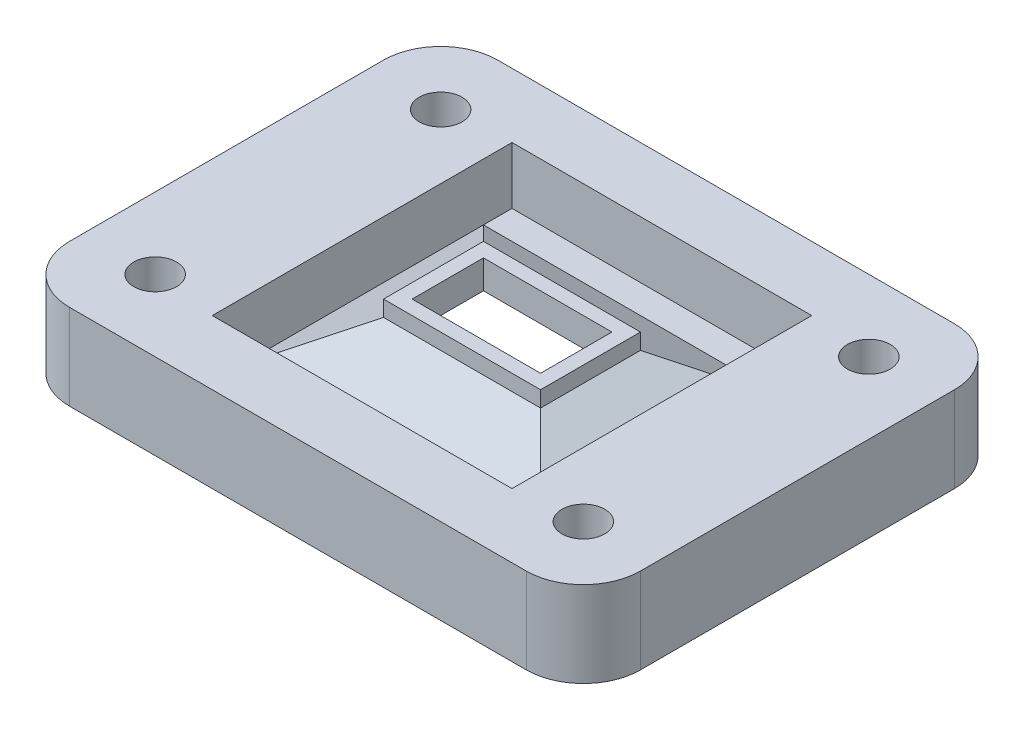
from build123d import *
from OCP.BRepFilletAPI import BRepFilletAPI_MakeChamfer

# Parameters (mm, degrees)
SKETCH1_W           = 40
SKETCH1_H           = 30
BOSS_EXTRUDE1_DEPTH = 6
SKETCH2_R           = 1.5
CUT_EXTRUDE1_DEPTH  = 6
FILLET1_R           = 4
SKETCH3_W           = 21
SKETCH3_H           = 21
CUT_EXTRUDE2_DEPTH  = 4
SKETCH6_W           = 9
SKETCH6_H           = 5
CUT_EXTRUDE3_DEPTH  = 2
SKETCH7_W           = 11
SKETCH7_H           = 7
SKETCH7_W_2         = 9
SKETCH7_H_2         = 5
BOSS_EXTRUDE2_DEPTH = 4
CHAMFER1_SIZE       = 4
CHAMFER1_SIZE2      = 6.92820323
CHAMFER2_SIZE       = 2.886751346
CHAMFER2_SIZE_2     = 5


with BuildPart() as part:
    # Sketch1 → Boss-Extrude1 (new body)
    with BuildSketch(Plane(origin=(0, 0, 0), x_dir=(1, 0, 0), z_dir=(0, 1, 0))):
        with Locations((20, 15)):
            Rectangle(SKETCH1_W, SKETCH1_H)
    extrude(amount=BOSS_EXTRUDE1_DEPTH)

    # Sketch2 → Cut-Extrude1 (cut)
    with BuildSketch(Plane(origin=(0, 6, 0), x_dir=(1, 0, 0), z_dir=(0, 1, 0))):
        with Locations(Location((5, 5, 0), (0, 0, 270))):
            Circle(SKETCH2_R)
        with Locations(Location((5, 25, 0), (0, 0, 90))):
            Circle(SKETCH2_R)
        with Locations(Location((35, 5, 0), (0, 0, 90))):
            Circle(SKETCH2_R)
        with Locations(Location((35, 25, 0), (0, 0, 270))):
            Circle(SKETCH2_R)
    extrude(amount=-CUT_EXTRUDE1_DEPTH, mode=Mode.SUBTRACT)

    # Fillet1
    fillet1_edges = [part.edges().sort_by_distance(p)[0] for p in [
        (0, 3, -30),
        (40, 3, -30),
        (40, 3, 0),
        (0, 3, 0),
    ]]
    fillet(fillet1_edges, radius=FILLET1_R)

    # Sketch3 → Cut-Extrude2 (cut)
    with BuildSketch(Plane(origin=(0, 6, 0), x_dir=(1, 0, 0), z_dir=(0, 1, 0))):
        with Locations((20, 15)):
            Rectangle(SKETCH3_W, SKETCH3_H)
    extrude(amount=-CUT_EXTRUDE2_DEPTH, mode=Mode.SUBTRACT)

    # Sketch6 → Cut-Extrude3 (cut)
    with BuildSketch(Plane(origin=(0, 2, 0), x_dir=(1, 0, 0), z_dir=(0, 1, 0))):
        with Locations((20, 15)):
            Rectangle(SKETCH6_W, SKETCH6_H)
    extrude(amount=-CUT_EXTRUDE3_DEPTH, mode=Mode.SUBTRACT)

    # Sketch7 → Boss-Extrude2 (add)
    with BuildSketch(Plane(origin=(0, 2, 0), x_dir=(1, 0, 0), z_dir=(0, 1, 0))):
        with Locations((20, 15)):
            Rectangle(SKETCH7_W, SKETCH7_H)
        with Locations((20, 15)):
            Rectangle(SKETCH7_W_2, SKETCH7_H_2, mode=Mode.SUBTRACT)
    extrude(amount=BOSS_EXTRUDE2_DEPTH)

    # Chamfer1: one chamfer whose edges measure the first distance from different faces: ONE call of the kernel's chamfer builder (chamfer() names one face for all edges)
    chamfer1_edges_1 = [part.edges().sort_by_distance(p)[0] for p in [
        (20, 0, -12.5),
    ]]
    chamfer1_side_1 = [part.faces().sort_by_distance(p)[0] for p in [
        (20, 3, -12.5),
    ]]
    chamfer1_edges_2 = [part.edges().sort_by_distance(p)[0] for p in [
        (24.5, 0, -15),
    ]]
    chamfer1_side_2 = [part.faces().sort_by_distance(p)[0] for p in [
        (24.5, 3, -15),
    ]]
    chamfer1_edges_3 = [part.edges().sort_by_distance(p)[0] for p in [
        (20, 0, -17.5),
    ]]
    chamfer1_side_3 = [part.faces().sort_by_distance(p)[0] for p in [
        (20, 3, -17.5),
    ]]
    chamfer1_edges_4 = [part.edges().sort_by_distance(p)[0] for p in [
        (15.5, 0, -15),
    ]]
    chamfer1_side_4 = [part.faces().sort_by_distance(p)[0] for p in [
        (15.5, 3, -15),
    ]]
    chamfer1 = BRepFilletAPI_MakeChamfer(part.part.solid().wrapped)
    for e in chamfer1_edges_1:
        chamfer1.Add(CHAMFER1_SIZE, CHAMFER1_SIZE2, e.wrapped, chamfer1_side_1[0].wrapped)  # the first distance lies on this face
    for e in chamfer1_edges_2:
        chamfer1.Add(CHAMFER1_SIZE, CHAMFER1_SIZE2, e.wrapped, chamfer1_side_2[0].wrapped)  # the first distance lies on this face
    for e in chamfer1_edges_3:
        chamfer1.Add(CHAMFER1_SIZE, CHAMFER1_SIZE2, e.wrapped, chamfer1_side_3[0].wrapped)  # the first distance lies on this face
    for e in chamfer1_edges_4:
        chamfer1.Add(CHAMFER1_SIZE, CHAMFER1_SIZE2, e.wrapped, chamfer1_side_4[0].wrapped)  # the first distance lies on this face
    add(Compound.cast(chamfer1.Shape()), mode=Mode.REPLACE)

    # Chamfer2
    # the kernel refuses this chamfer: 5, 2.886751346 mm, written as the material it adds along each edge
    with BuildSketch(Plane(origin=(14.5, 2, -31.435428773), x_dir=(0, 1, 0), z_dir=(0, 0, 1))) as chamfer2_piece_1_section:
        Polygon((CHAMFER2_SIZE, 0), (0, CHAMFER2_SIZE_2), (0, 0), align=None)
    chamfer2_piece_1 = extrude(amount=32.870857546, mode=Mode.PRIVATE)
    chamfer2_piece_1 = split(chamfer2_piece_1, bisect_by=Plane(origin=(13.883974596, 3.066987298, -31.435428773), z_dir=(-0.499999999999998, 0.8660254037844398, 0)), keep=Keep.TOP, mode=Mode.PRIVATE)
    chamfer2_piece_1 = split(chamfer2_piece_1, bisect_by=Plane(origin=(14.5, -1.436141454, -29.45157158), z_dir=(0, -0.8660254037844382, 0.500000000000001)), keep=Keep.TOP, mode=Mode.PRIVATE)
    chamfer2_piece_1 = split(chamfer2_piece_1, bisect_by=Plane(origin=(14.5, 12.797357386, -25.20157158), z_dir=(0, -0.8660254037844382, -0.500000000000001)), keep=Keep.TOP, mode=Mode.PRIVATE)
    with BuildSketch(Plane(origin=(14.5, 2, -31.435428773), x_dir=(0, 1, 0), z_dir=(0, 0, 1))) as chamfer2_piece_2_section:
        Polygon((CHAMFER2_SIZE, 0), (0, CHAMFER2_SIZE_2), (0, 0), align=None)
    chamfer2_piece_2 = extrude(amount=32.870857546, mode=Mode.PRIVATE)
    chamfer2_piece_2 = split(chamfer2_piece_2, bisect_by=Plane(origin=(14.5, -2.534217665, -28.817596984), z_dir=(0, 0.8660254037844398, -0.499999999999998)), keep=Keep.TOP, mode=Mode.PRIVATE)
    chamfer2_piece_2 = split(chamfer2_piece_2, bisect_by=Plane(origin=(14.5, -1.436141454, -29.45157158), z_dir=(0, -0.8660254037844382, 0.500000000000001)), keep=Keep.TOP, mode=Mode.PRIVATE)
    with BuildSketch(Plane(origin=(14.5, 2, -31.435428773), x_dir=(0, 1, 0), z_dir=(0, 0, 1))) as chamfer2_piece_3_section:
        Polygon((CHAMFER2_SIZE, 0), (0, CHAMFER2_SIZE_2), (0, 0), align=None)
    chamfer2_piece_3 = extrude(amount=32.870857546, mode=Mode.PRIVATE)
    chamfer2_piece_3 = split(chamfer2_piece_3, bisect_by=Plane(origin=(14.5, 11.699281175, -25.835546176), z_dir=(0, 0.8660254037844398, 0.49999999999999795)), keep=Keep.TOP, mode=Mode.PRIVATE)
    chamfer2_piece_3 = split(chamfer2_piece_3, bisect_by=Plane(origin=(14.5, 12.797357386, -25.20157158), z_dir=(0, -0.8660254037844382, -0.500000000000001)), keep=Keep.TOP, mode=Mode.PRIVATE)
    with BuildSketch(Plane(origin=(1.564571227, 2, -11.5), x_dir=(0, 1, 0), z_dir=(1, 0, 0))) as chamfer2_piece_4_section:
        Polygon((CHAMFER2_SIZE, 0), (0, CHAMFER2_SIZE_2), (0, 0), align=None)
    chamfer2_piece_4 = extrude(amount=36.870857546, mode=Mode.PRIVATE)
    chamfer2_piece_4 = split(chamfer2_piece_4, bisect_by=Plane(origin=(1.564571227, 3.066987298, -10.883974596), z_dir=(0, 0.8660254037844398, 0.49999999999999795)), keep=Keep.TOP, mode=Mode.PRIVATE)
    chamfer2_piece_4 = split(chamfer2_piece_4, bisect_by=Plane(origin=(8.79842842, 14.529408194, -11.5), z_dir=(-0.500000000000001, -0.8660254037844382, 0)), keep=Keep.TOP, mode=Mode.PRIVATE)
    chamfer2_piece_4 = split(chamfer2_piece_4, bisect_by=Plane(origin=(3.54842842, -1.436141454, -11.5), z_dir=(0.500000000000001, -0.8660254037844382, 0)), keep=Keep.TOP, mode=Mode.PRIVATE)
    with BuildSketch(Plane(origin=(1.564571227, 2, -11.5), x_dir=(0, 1, 0), z_dir=(1, 0, 0))) as chamfer2_piece_5_section:
        Polygon((CHAMFER2_SIZE, 0), (0, CHAMFER2_SIZE_2), (0, 0), align=None)
    chamfer2_piece_5 = extrude(amount=36.870857546, mode=Mode.PRIVATE)
    chamfer2_piece_5 = split(chamfer2_piece_5, bisect_by=Plane(origin=(4.182403016, -2.534217665, -11.5), z_dir=(-0.499999999999998, 0.8660254037844398, 0)), keep=Keep.TOP, mode=Mode.PRIVATE)
    chamfer2_piece_5 = split(chamfer2_piece_5, bisect_by=Plane(origin=(3.54842842, -1.436141454, -11.5), z_dir=(0.500000000000001, -0.8660254037844382, 0)), keep=Keep.TOP, mode=Mode.PRIVATE)
    with BuildSketch(Plane(origin=(25.5, 2, 1.435428773), x_dir=(0, 1, 0), z_dir=(0, 0, -1))) as chamfer2_piece_6_section:
        Polygon((CHAMFER2_SIZE, 0), (0, CHAMFER2_SIZE_2), (0, 0), align=None)
    chamfer2_piece_6 = extrude(amount=32.870857546, mode=Mode.PRIVATE)
    chamfer2_piece_6 = split(chamfer2_piece_6, bisect_by=Plane(origin=(26.116025404, 3.066987298, 1.435428773), z_dir=(0.499999999999998, 0.8660254037844398, 0)), keep=Keep.TOP, mode=Mode.PRIVATE)
    chamfer2_piece_6 = split(chamfer2_piece_6, bisect_by=Plane(origin=(25.5, 12.797357386, -4.79842842), z_dir=(0, -0.8660254037844382, 0.500000000000001)), keep=Keep.TOP, mode=Mode.PRIVATE)
    chamfer2_piece_6 = split(chamfer2_piece_6, bisect_by=Plane(origin=(25.5, -1.436141454, -0.54842842), z_dir=(0, -0.8660254037844382, -0.500000000000001)), keep=Keep.TOP, mode=Mode.PRIVATE)
    with BuildSketch(Plane(origin=(25.5, 2, 1.435428773), x_dir=(0, 1, 0), z_dir=(0, 0, -1))) as chamfer2_piece_7_section:
        Polygon((CHAMFER2_SIZE, 0), (0, CHAMFER2_SIZE_2), (0, 0), align=None)
    chamfer2_piece_7 = extrude(amount=32.870857546, mode=Mode.PRIVATE)
    chamfer2_piece_7 = split(chamfer2_piece_7, bisect_by=Plane(origin=(25.5, -2.534217665, -1.182403016), z_dir=(0, 0.8660254037844398, 0.49999999999999795)), keep=Keep.TOP, mode=Mode.PRIVATE)
    chamfer2_piece_7 = split(chamfer2_piece_7, bisect_by=Plane(origin=(25.5, -1.436141454, -0.54842842), z_dir=(0, -0.8660254037844382, -0.500000000000001)), keep=Keep.TOP, mode=Mode.PRIVATE)
    with BuildSketch(Plane(origin=(25.5, 2, 1.435428773), x_dir=(0, 1, 0), z_dir=(0, 0, -1))) as chamfer2_piece_8_section:
        Polygon((CHAMFER2_SIZE, 0), (0, CHAMFER2_SIZE_2), (0, 0), align=None)
    chamfer2_piece_8 = extrude(amount=32.870857546, mode=Mode.PRIVATE)
    chamfer2_piece_8 = split(chamfer2_piece_8, bisect_by=Plane(origin=(25.5, 11.699281175, -4.164453824), z_dir=(0, 0.8660254037844398, -0.499999999999998)), keep=Keep.TOP, mode=Mode.PRIVATE)
    chamfer2_piece_8 = split(chamfer2_piece_8, bisect_by=Plane(origin=(25.5, 12.797357386, -4.79842842), z_dir=(0, -0.8660254037844382, 0.500000000000001)), keep=Keep.TOP, mode=Mode.PRIVATE)
    with BuildSketch(Plane(origin=(38.435428773, 2, -18.5), x_dir=(0, 1, 0), z_dir=(-1, 0, 0))) as chamfer2_piece_9_section:
        Polygon((CHAMFER2_SIZE, 0), (0, CHAMFER2_SIZE_2), (0, 0), align=None)
    chamfer2_piece_9 = extrude(amount=36.870857546, mode=Mode.PRIVATE)
    chamfer2_piece_9 = split(chamfer2_piece_9, bisect_by=Plane(origin=(38.435428773, 3.066987298, -19.116025404), z_dir=(0, 0.8660254037844398, -0.499999999999998)), keep=Keep.TOP, mode=Mode.PRIVATE)
    chamfer2_piece_9 = split(chamfer2_piece_9, bisect_by=Plane(origin=(36.45157158, -1.436141454, -18.5), z_dir=(-0.500000000000001, -0.8660254037844382, 0)), keep=Keep.TOP, mode=Mode.PRIVATE)
    chamfer2_piece_9 = split(chamfer2_piece_9, bisect_by=Plane(origin=(31.20157158, 14.529408194, -18.5), z_dir=(0.500000000000001, -0.8660254037844382, 0)), keep=Keep.TOP, mode=Mode.PRIVATE)
    with BuildSketch(Plane(origin=(38.435428773, 2, -18.5), x_dir=(0, 1, 0), z_dir=(-1, 0, 0))) as chamfer2_piece_10_section:
        Polygon((CHAMFER2_SIZE, 0), (0, CHAMFER2_SIZE_2), (0, 0), align=None)
    chamfer2_piece_10 = extrude(amount=36.870857546, mode=Mode.PRIVATE)
    chamfer2_piece_10 = split(chamfer2_piece_10, bisect_by=Plane(origin=(31.835546176, 13.431331982, -18.5), z_dir=(-0.499999999999998, 0.8660254037844398, 0)), keep=Keep.TOP, mode=Mode.PRIVATE)
    chamfer2_piece_10 = split(chamfer2_piece_10, bisect_by=Plane(origin=(31.20157158, 14.529408194, -18.5), z_dir=(0.500000000000001, -0.8660254037844382, 0)), keep=Keep.TOP, mode=Mode.PRIVATE)
    add([chamfer2_piece_1, chamfer2_piece_2, chamfer2_piece_3, chamfer2_piece_4, chamfer2_piece_5, chamfer2_piece_6, chamfer2_piece_7, chamfer2_piece_8, chamfer2_piece_9, chamfer2_piece_10])


solid = part.part
